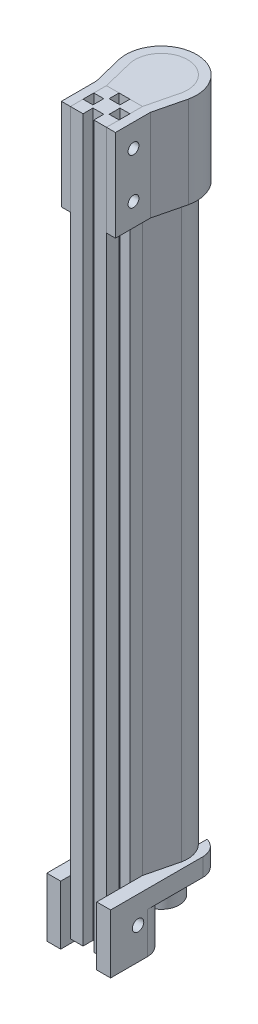
from build123d import *

# Parameters (mm, degrees)
BOSS_EXTRUDE1_DEPTH = 369.57
SKETCH2_W           = 20
SKETCH2_H           = 20
BOSS_EXTRUDE2_DEPTH = 400
SKETCH7_W           = 5.5
SKETCH7_H           = 6
SKETCH7_W_2         = 6
SKETCH7_H_2         = 5.5
CUT_EXTRUDE3_DEPTH  = 403.300358004
BOSS_EXTRUDE3_DEPTH = 50.8
SKETCH9_R           = 3
CUT_EXTRUDE4_DEPTH  = 374.378310765
SKETCH10_R          = 9.975
BOSS_EXTRUDE4_DEPTH = 24.4221
SKETCH11_W          = 35.4
SKETCH11_H          = 10
BOSS_EXTRUDE5_DEPTH = 10
SKETCH12_W          = 35.4
SKETCH12_H          = 5
BOSS_EXTRUDE6_DEPTH = 22.7
SKETCH14_R          = 3.175
CUT_EXTRUDE5_DEPTH  = 372.74043219
SKETCH15_W          = 7.7
SKETCH15_H          = 32.7
BOSS_EXTRUDE7_DEPTH = 25.4
SKETCH16_R          = 3.175
CUT_EXTRUDE6_DEPTH  = 375.260604325
SKETCH17_W          = 7.225
SKETCH17_H          = 10
BOSS_EXTRUDE8_DEPTH = 25.4
FILLET1_R           = 10


with BuildPart() as part:
    # Sketch1 → Boss-Extrude1 (new body)
    with BuildSketch(Plane(origin=(0, 0, 0), x_dir=(1, 0, 0), z_dir=(0, 1, 0))):
        with BuildLine():
            Line((14.298722896, -2.925841512), (10, -20.405))
            Line((10, -20.405), (-10, -20.405))
            Line((-10, -20.405), (-14.298722896, -2.925841512))
            ThreePointArc((-14.298722896, -2.925841512), (0, 14.595), (14.298722896, -2.925841512))
        make_face()
    extrude(amount=BOSS_EXTRUDE1_DEPTH)

    # Sketch10 → Boss-Extrude4 (add)
    with BuildSketch(Plane.XZ):
        with Locations(Location((0, 0, 0), (0, 0, 270))):
            Circle(SKETCH10_R)
    extrude(amount=BOSS_EXTRUDE4_DEPTH)


with BuildPart() as body_2:
    # Sketch2 → Boss-Extrude2 (new body)
    with BuildSketch(Plane(origin=(0, 369.57, 0), x_dir=(1, 0, 0), z_dir=(0, 1, 0))):
        with Locations((0, -30.405)):
            Rectangle(SKETCH2_W, SKETCH2_H)
    extrude(amount=-BOSS_EXTRUDE2_DEPTH)

    # Sketch7 → Cut-Extrude3 (cut, through all)
    with BuildSketch(Plane(origin=(0, 369.57, 0), x_dir=(1, 0, 0), z_dir=(0, 1, 0))):
        with Locations((7.25, -30.405)):
            Rectangle(SKETCH7_W, SKETCH7_H)
        with Locations((-7.25, -30.405)):
            Rectangle(SKETCH7_W, SKETCH7_H)
        with Locations((0, -23.155)):
            Rectangle(SKETCH7_W_2, SKETCH7_H_2)
        with Locations((0, -37.655)):
            Rectangle(SKETCH7_W_2, SKETCH7_H_2)
    extrude(amount=-CUT_EXTRUDE3_DEPTH, mode=Mode.SUBTRACT)


with BuildPart() as body_3:
    # Sketch8 → Boss-Extrude3 (new body)
    with BuildSketch(Plane(origin=(0, 369.57, 0), x_dir=(1, 0, 0), z_dir=(0, 1, 0))):
        with BuildLine():
            Line((-10, -40.405), (-10, -20.405))
            Line((-10, -20.405), (-14.298722896, -2.925841512))
            ThreePointArc((-14.298722896, -2.925841512), (0, 14.595), (14.298722896, -2.925841512))
            Line((14.298722896, -2.925841512), (10, -20.405))
            Line((10, -20.405), (10, -40.405))
            Line((10, -40.405), (15, -40.405))
            Line((15, -40.405), (15, -21.010809591))
            Line((15, -21.010809591), (19.175792464, -4.031502))
            ThreePointArc((19.175792464, -4.031502), (0, 19.595), (-19.175792464, -4.031502))
            Line((-19.175792464, -4.031502), (-15, -21.010809591))
            Line((-15, -21.010809591), (-15, -40.405))
            Line((-15, -40.405), (-10, -40.405))
        make_face()
    extrude(amount=-BOSS_EXTRUDE3_DEPTH)


with BuildPart() as cut_extrude4_tool:
    # Sketch9 → Cut-Extrude4 (new, through all)
    with BuildSketch(Plane.ZY.offset(15)):
        with Locations((30.405, 356.87)):
            Circle(SKETCH9_R)
        with Locations(Location((30.405, 331.47, 0), (0, 0, 180))):
            Circle(SKETCH9_R)
    extrude(amount=-CUT_EXTRUDE4_DEPTH)


with BuildPart() as body_2_1:
    add(body_2.part)

    # Cut-Extrude4: cut by cut_extrude4_tool
    add(cut_extrude4_tool.part, mode=Mode.SUBTRACT)


with BuildPart() as body_3_1:
    add(body_3.part)

    # Cut-Extrude4: cut by cut_extrude4_tool
    add(cut_extrude4_tool.part, mode=Mode.SUBTRACT)


with BuildPart() as body_4:
    # Sketch11 → Boss-Extrude5 (new body)
    with BuildSketch(Plane.XZ):
        with Locations((0, 15.405)):
            Rectangle(SKETCH11_W, SKETCH11_H)
    extrude(amount=BOSS_EXTRUDE5_DEPTH)

    # Sketch12 → Boss-Extrude6 (add)
    with BuildSketch(Plane.XZ.offset(10)):
        with Locations((0, 17.905)):
            Rectangle(SKETCH12_W, SKETCH12_H)
    extrude(amount=BOSS_EXTRUDE6_DEPTH)

    # Sketch14 → Cut-Extrude5 (cut, through all)
    with BuildSketch(Plane(origin=(0, 0, 15.405), x_dir=(-1, 0, 0), z_dir=(0, 0, -1))):
        with Locations((0, -15)):
            Circle(SKETCH14_R)
    extrude(amount=-CUT_EXTRUDE5_DEPTH, mode=Mode.SUBTRACT)

    # Sketch15 → Boss-Extrude7 (add)
    with BuildSketch(Plane.XY.offset(20.405)):
        with Locations((-13.85, -16.35)):
            Rectangle(SKETCH15_W, SKETCH15_H)
        with Locations((13.85, -16.35)):
            Rectangle(SKETCH15_W, SKETCH15_H)
    extrude(amount=BOSS_EXTRUDE7_DEPTH)

    # Sketch16 → Cut-Extrude6 (cut, through all)
    with BuildSketch(Plane(origin=(17.7, 0, 0), x_dir=(0, 0, -1), z_dir=(1, 0, 0))):
        with Locations((-30.58, -15)):
            Circle(SKETCH16_R)
    extrude(amount=-CUT_EXTRUDE6_DEPTH, mode=Mode.SUBTRACT)

    # Sketch17 → Boss-Extrude8 (add)
    with BuildSketch(Plane(origin=(0, 0, 10.405), x_dir=(-1, 0, 0), z_dir=(0, 0, -1))):
        with Locations((14.0875, -5)):
            Rectangle(SKETCH17_W, SKETCH17_H)
        with Locations((-14.0875, -5)):
            Rectangle(SKETCH17_W, SKETCH17_H)
    extrude(amount=BOSS_EXTRUDE8_DEPTH)

    # Fillet1
    # the kernel refuses this fillet: 10 mm, written as the material it takes off along each edge
    with BuildSketch(Plane(origin=(17.7, -10, 15.405), x_dir=(0, 0, 1), z_dir=(0, -1, 0))) as fillet1_piece_1:
        with BuildLine():
            CenterArc((FILLET1_R, FILLET1_R), FILLET1_R, 180, 90)
            Line((0, FILLET1_R), (0, 0))
            Line((0, 0), (FILLET1_R, 0))
        make_face()
    extrude(amount=47.7, mode=Mode.SUBTRACT)
    with BuildSketch(Plane(origin=(-17.7, -10, 15.405), x_dir=(0, 0, 1), z_dir=(0, -1, 0))) as fillet1_piece_2:
        with BuildLine():
            CenterArc((FILLET1_R, -FILLET1_R), FILLET1_R, 90, 90)
            Line((0, -FILLET1_R), (0, 0))
            Line((0, 0), (FILLET1_R, 0))
        make_face()
    extrude(amount=47.7, mode=Mode.SUBTRACT)
    with BuildSketch(Plane(origin=(17.7, -34.01814093, -14.995), x_dir=(0, 0, 1), z_dir=(0, 1, 0))) as fillet1_piece_3:
        with BuildLine():
            CenterArc((9.607256372, -10), FILLET1_R, 90, 73.888946597)
            Line((0, -7.225), (0, 0))
            Line((0, 0), (9.607256372, 0))
        make_face()
    extrude(amount=58.036281861, mode=Mode.SUBTRACT)
    with BuildSketch(Plane(origin=(-17.7, 24.01814093, -14.995), x_dir=(1, 0, 0), z_dir=(0, -1, 0))) as fillet1_piece_4:
        with BuildLine():
            CenterArc((10, 9.607256372), FILLET1_R, 180, 73.888946597)
            Line((0, 9.607256372), (0, 0))
            Line((0, 0), (7.225, 0))
        make_face()
    extrude(amount=58.036281861, mode=Mode.SUBTRACT)


solid = Compound([part.part, body_2_1.part, body_3_1.part, body_4.part])
